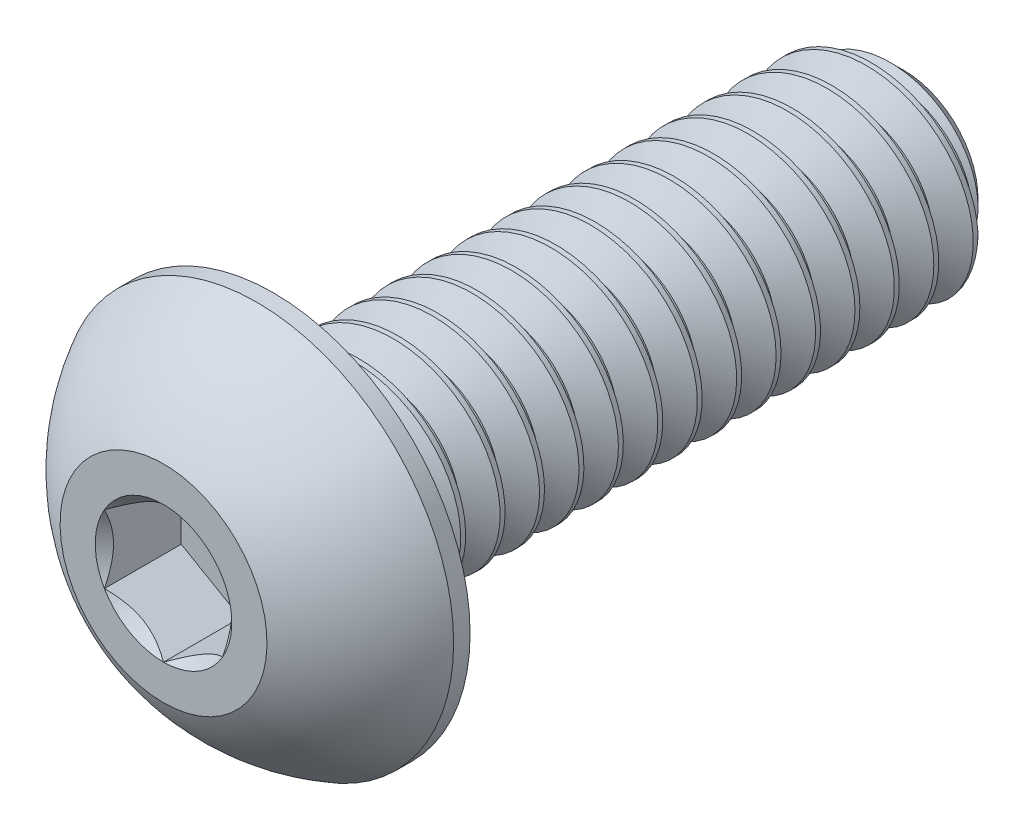
from build123d import *

# Parameters (mm, degrees)
SKETCH1_W          = 12.7
SKETCH1_H          = 2.0828
CHAMFER1_SIZE      = 0.5953125
CUT_SWEEP1_PITCH   = 0.79375
CUT_EXTRUDE2_DEPTH = 1.54686


with BuildPart() as part:
    # Sketch1 → Revolve1 (revolve)
    with BuildSketch(Plane(origin=(0, 0, 0), x_dir=(0, 0, -1), z_dir=(1, 0, 0))):
        with Locations((8.5598, 1.0414)):
            Rectangle(SKETCH1_W, SKETCH1_H)
    revolve(axis=Axis((0, 0, -14.9098), (0, 0, 1)))

    # Chamfer1
    chamfer1_edges = [part.edges().sort_by_distance(p)[0] for p in [
        (0, -2.0828, -14.9098),
    ]]
    chamfer(chamfer1_edges, length=CHAMFER1_SIZE)

    # Cut-Sweep1: the profile of Sketch2 profile screwed along a right-hand helix of 17 turns, 8 arcs to a turn; built about Z, then put on its axis
    cut_sweep1_z = Axis((0, 0, 0), (0, 0, 1))
    cut_sweep1_corners = [(2.0831, 0, 0.000173205), (2.0831, 0, -0.694704455), (1.567244252, 0, -0.396875), (1.567244252, 0, -0.29765625)]
    with BuildLine(mode=Mode.PRIVATE) as cut_sweep1_profile:
        Line(cut_sweep1_corners[0], cut_sweep1_corners[1])
        Line(cut_sweep1_corners[1], cut_sweep1_corners[2])
        Line(cut_sweep1_corners[2], cut_sweep1_corners[3])
        Line(cut_sweep1_corners[3], cut_sweep1_corners[0])
    cut_sweep1_cap = Face(cut_sweep1_profile.wire())
    cut_sweep1_turn_angles = [0, 22.5, 45, 67.5, 90, 112.5, 135, 157.5, 180, 202.5, 225, 247.5, 270, 292.5, 315, 337.5, 360]
    cut_sweep1_turn_weights = [1, 0.9238795325112867, 1, 0.9238795325112867, 1, 0.9238795325112867, 1, 0.9238795325112867, 1, 0.9238795325112867, 1, 0.9238795325112867, 1, 0.9238795325112867, 1, 0.9238795325112867, 1]
    cut_sweep1_turn_rails = [Edge.make_bspline([Vector(p[0], p[1], 0).rotate(cut_sweep1_z, cut_sweep1_turn_angles[k]) / cut_sweep1_turn_weights[k] + Vector(0, 0, p[2] + CUT_SWEEP1_PITCH * cut_sweep1_turn_angles[k] / 360) for k in range(17)], [0, 0, 0, 1, 1, 2, 2, 3, 3, 4, 4, 5, 5, 6, 6, 7, 7, 8, 8, 8], 2, cut_sweep1_turn_weights) for p in cut_sweep1_corners]
    cut_sweep1_turn_sides = [Face.make_surface_from_curves(cut_sweep1_turn_rails[p[0]], cut_sweep1_turn_rails[p[1]]) for p in [(0, 1), (1, 2), (2, 3), (3, 0)]]
    cut_sweep1 = Plane(origin=(0, 0, -14.9098), x_dir=(0, 1, 0), z_dir=(0, 0, 1)) * Solid(Shell([*[p.moved(Location((0, 0, CUT_SWEEP1_PITCH * i))) for i in range(17) for p in cut_sweep1_turn_sides], cut_sweep1_cap, cut_sweep1_cap.rotate(cut_sweep1_z, 6120).moved(Location((0, 0, CUT_SWEEP1_PITCH * 6120 / 360)))]))
    add(cut_sweep1, mode=Mode.SUBTRACT)

    # Sketch7 → Revolve2 (revolve)
    with BuildSketch(Plane(origin=(0, 0, 0), x_dir=(0, 0, -1), z_dir=(1, 0, 0)), mode=Mode.PRIVATE) as revolve2_sk:
        with BuildLine():
            Line((1.87833, 3.9624), (2.2098, 3.9624))
            Line((2.2098, 3.9624), (2.2098, 0))
            Line((2.2098, 0), (0, 0))
            Line((0, 0), (0, 2.0828))
            ThreePointArc((0, 2.0828), (0.796523813, 3.165144808), (1.87833, 3.9624))
        make_face()
    revolve(revolve2_sk.sketch.rotate(Axis((0, 0, 0), (0, 0, -1)), 189.052465709), axis=Axis((0, 0, 0), (0, 0, -1)))

    # Sketch5 → Cut-Extrude2 (cut)
    with BuildSketch(Plane.XY):
        Polygon((1.190625, -0.687407664), (1.190625, 0.687407664), (0, 1.374815329), (-1.190625, 0.687407664), (-1.190625, -0.687407664), (0, -1.374815329), align=None)
    extrude(amount=-CUT_EXTRUDE2_DEPTH, mode=Mode.SUBTRACT)

    # Cut-Extrude3 cone 1 section (through the dimple's axis) → Cut-Extrude3 (revolve, cut)
    with BuildSketch(Plane(origin=(0, 0, 0), x_dir=(0, -1, 0), z_dir=(1, 0, 0))):
        Polygon((0, 0), (1.374815329, 0), (0, 1.374815329), align=None)
    revolve(axis=Axis((0, 0, 0), (0, 0, -1)), mode=Mode.SUBTRACT)


solid = part.part
